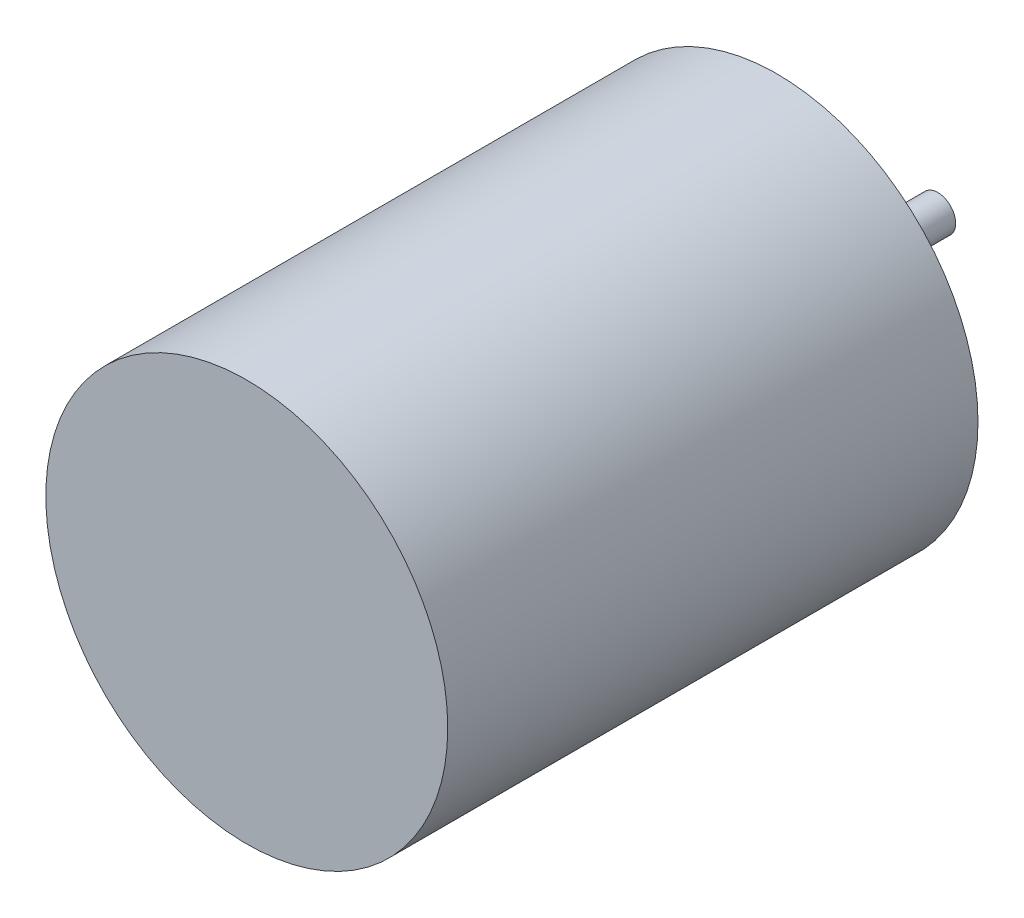
from build123d import *

# Parameters (mm, degrees)
SKETCH1_R           = 71.4375
BOSS_EXTRUDE1_DEPTH = 188.4934
SKETCH2_R           = 6.35
BOSS_EXTRUDE2_DEPTH = 57.15


with BuildPart() as part:
    # Sketch1 → Boss-Extrude1 (new body)
    with BuildSketch(Plane.XY):
        Circle(SKETCH1_R)
    extrude(amount=BOSS_EXTRUDE1_DEPTH)

    # Sketch2 → Boss-Extrude2 (add)
    with BuildSketch(Plane.XY):
        Circle(SKETCH2_R)
    extrude(amount=-BOSS_EXTRUDE2_DEPTH)


solid = part.part
